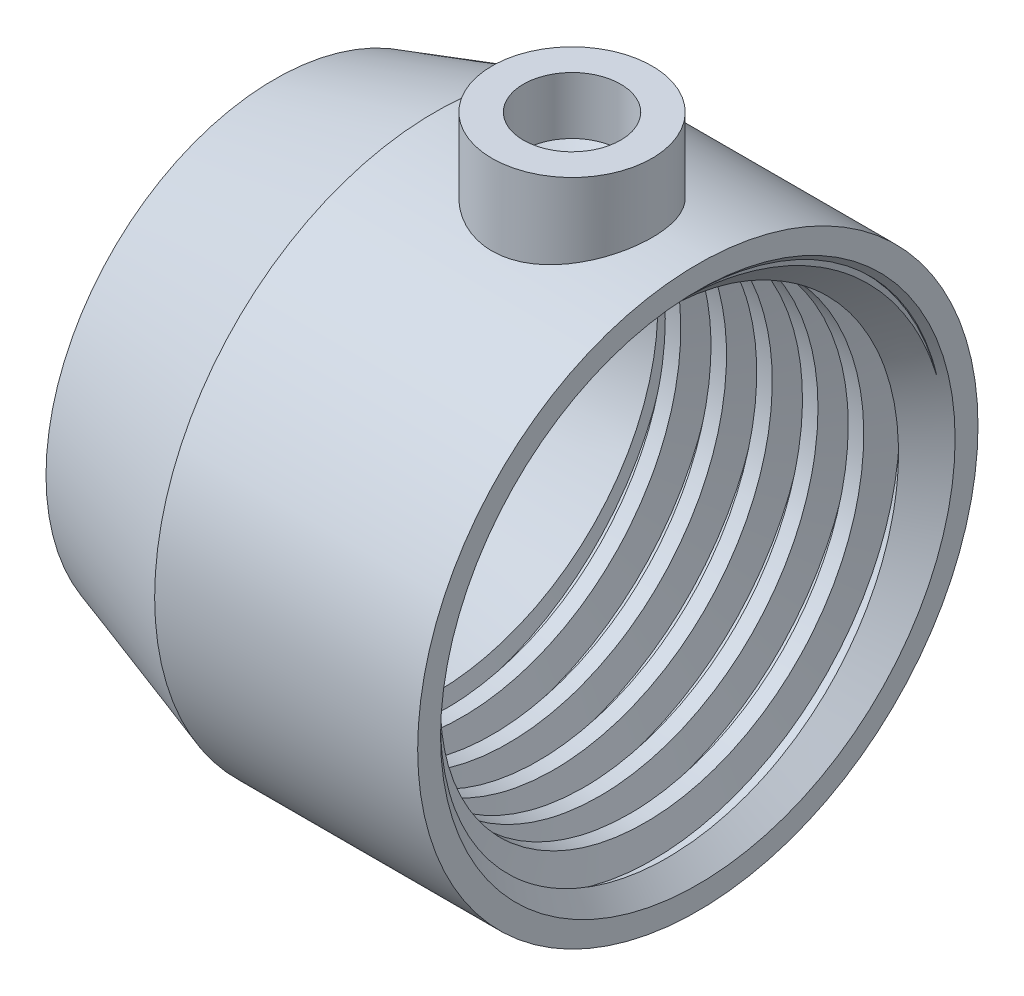
from build123d import *

# Parameters (mm, degrees)
CHAMFER1_SIZE              = 3
CUT_SWEEP1_PITCH           = 4
BOSS_EXTRUDE1_REACH        = 72.67
BOSS_EXTRUDE1_END_RADIUS   = 24.5
SKETCH7_R                  = 7
M10X1_5_TAPPED_HOLE1_D     = 8.5
M10X1_5_TAPPED_HOLE1_DEPTH = 5
M10X1_5_TAPPED_HOLE1_TIP   = 2.553657631


with BuildPart() as part:
    # Sketch1 → Revolve1 (revolve)
    with BuildSketch(Plane.XY, mode=Mode.PRIVATE) as revolve1_sk:
        Polygon((0, 13.5), (0, 20), (14, 24.5), (37, 24.5), (37, 19.5), (14, 19.5), (3, 15.964285714), (3, 13.5), align=None)
    revolve(revolve1_sk.sketch.rotate(Axis((0, 0, 0), (1, 0, 0)), 90), axis=Axis((0, 0, 0), (1, 0, 0)))

    # Chamfer1
    chamfer1_edges = [part.edges().sort_by_distance(p)[0] for p in [
        (37, 0, -19.5),
    ]]
    chamfer(chamfer1_edges, length=CHAMFER1_SIZE)

    # Cut-Sweep1: arcs per turn and ends read off the stored shape
    # Cut-Sweep1: the profile of Sketch4 profile screwed along a left-hand helix through 6.5 turns, 12 arcs to a turn; built about Z, then put on its axis
    cut_sweep1_z = Axis((0, 0, 0), (0, 0, 1))
    cut_sweep1_corners = [(19.4997, 0, 7.7585e-05), (19.4997, 0, -2.643165507), (22, 0, -1.996543961), (22, 0, -0.646543961)]
    with BuildLine(mode=Mode.PRIVATE) as cut_sweep1_profile:
        Line(cut_sweep1_corners[0], cut_sweep1_corners[1])
        Line(cut_sweep1_corners[1], cut_sweep1_corners[2])
        Line(cut_sweep1_corners[2], cut_sweep1_corners[3])
        Line(cut_sweep1_corners[3], cut_sweep1_corners[0])
    cut_sweep1_cap = Face(cut_sweep1_profile.wire())
    cut_sweep1_turn_angles = [0, -15, -30, -45, -60, -75, -90, -105, -120, -135, -150, -165, -180, -195, -210, -225, -240, -255, -270, -285, -300, -315, -330, -345, -360]
    cut_sweep1_turn_weights = [1, 0.9659258262890683, 1, 0.9659258262890683, 1, 0.9659258262890683, 1, 0.9659258262890683, 1, 0.9659258262890683, 1, 0.9659258262890683, 1, 0.9659258262890683, 1, 0.9659258262890683, 1, 0.9659258262890683, 1, 0.9659258262890683, 1, 0.9659258262890683, 1, 0.9659258262890683, 1]
    cut_sweep1_turn_rails = [Edge.make_bspline([Vector(p[0], p[1], 0).rotate(cut_sweep1_z, cut_sweep1_turn_angles[k]) / cut_sweep1_turn_weights[k] + Vector(0, 0, p[2] + -CUT_SWEEP1_PITCH * cut_sweep1_turn_angles[k] / 360) for k in range(25)], [0, 0, 0, 1, 1, 2, 2, 3, 3, 4, 4, 5, 5, 6, 6, 7, 7, 8, 8, 9, 9, 10, 10, 11, 11, 12, 12, 12], 2, cut_sweep1_turn_weights) for p in cut_sweep1_corners]
    cut_sweep1_turn_sides = [Face.make_surface_from_curves(cut_sweep1_turn_rails[p[0]], cut_sweep1_turn_rails[p[1]]) for p in [(0, 1), (1, 2), (2, 3), (3, 0)]]
    cut_sweep1_last_angles = [-2160, -2175, -2190, -2205, -2220, -2235, -2250, -2265, -2280, -2295, -2310, -2325, -2340]
    cut_sweep1_last_weights = [1, 0.9659258262890683, 1, 0.9659258262890683, 1, 0.9659258262890683, 1, 0.9659258262890683, 1, 0.9659258262890683, 1, 0.9659258262890683, 1]
    cut_sweep1_last_rails = [Edge.make_bspline([Vector(p[0], p[1], 0).rotate(cut_sweep1_z, cut_sweep1_last_angles[k]) / cut_sweep1_last_weights[k] + Vector(0, 0, p[2] + -CUT_SWEEP1_PITCH * cut_sweep1_last_angles[k] / 360) for k in range(13)], [0, 0, 0, 1, 1, 2, 2, 3, 3, 4, 4, 5, 5, 6, 6, 6], 2, cut_sweep1_last_weights) for p in cut_sweep1_corners]
    cut_sweep1_last_sides = [Face.make_surface_from_curves(cut_sweep1_last_rails[p[0]], cut_sweep1_last_rails[p[1]]) for p in [(0, 1), (1, 2), (2, 3), (3, 0)]]
    cut_sweep1 = Plane(origin=(37, 0, 0), x_dir=(0, -1, 0), z_dir=(-1, 0, 0)) * Solid(Shell([*[p.moved(Location((0, 0, CUT_SWEEP1_PITCH * i))) for i in range(6) for p in cut_sweep1_turn_sides], *cut_sweep1_last_sides, cut_sweep1_cap, cut_sweep1_cap.rotate(cut_sweep1_z, -2340).moved(Location((0, 0, -CUT_SWEEP1_PITCH * -2340 / 360)))]))
    add(cut_sweep1, mode=Mode.SUBTRACT)

    # Boss-Extrude1: up to this cylinder (the profile starts outside it)
    boss_extrude1_end = Plane(origin=(26, 0, 0), z_dir=(-1, 0, 0)) * Cylinder(BOSS_EXTRUDE1_END_RADIUS, 195.34, mode=Mode.PRIVATE)
    # Sketch7 → Boss-Extrude1 (add, up to the surface)
    with BuildSketch(Plane(origin=(0, 30.5, 0), x_dir=(1, 0, 0), z_dir=(0, 1, 0)), mode=Mode.PRIVATE) as boss_extrude1_sk1:
        with Locations(Location((26, 0, 0), (0, 0, 270))):
            Circle(SKETCH7_R)
    boss_extrude1_tool1 = extrude(boss_extrude1_sk1.sketch, amount=-BOSS_EXTRUDE1_REACH, mode=Mode.PRIVATE) - boss_extrude1_end
    add(boss_extrude1_tool1.solids().sort_by_distance((26, 30.5, 0))[0])

    # M10x1.5 Tapped Hole1
    with Locations(Plane(origin=(0, 30.5, 0), x_dir=(1, 0, 0), z_dir=(0, 1, 0))):
        with Locations((26, 0)):
            Hole(M10X1_5_TAPPED_HOLE1_D / 2, depth=M10X1_5_TAPPED_HOLE1_DEPTH)
            with Locations((0, 0, -(M10X1_5_TAPPED_HOLE1_DEPTH + M10X1_5_TAPPED_HOLE1_TIP / 2))):  # 118° drill point
                Cone(0, M10X1_5_TAPPED_HOLE1_D / 2, M10X1_5_TAPPED_HOLE1_TIP, mode=Mode.SUBTRACT)


solid = part.part
